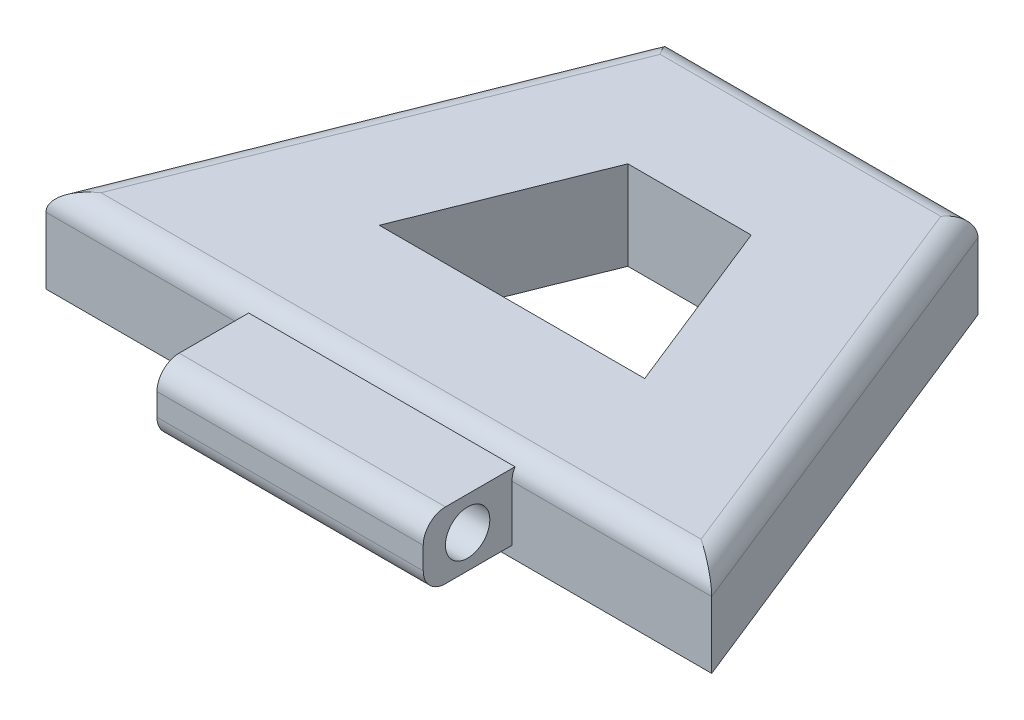
from build123d import *

# Parameters (mm, degrees)
BOSS_EXTRUDE1_DEPTH = 20
SKETCH2_W           = 60
SKETCH2_H           = 15
BOSS_EXTRUDE2_DEPTH = 20
SKETCH3_R           = 5
CUT_EXTRUDE1_DEPTH  = 147.372811683
FILLET1_R           = 5


with BuildPart() as part:
    # Sketch1 → Boss-Extrude1 (new body)
    with BuildSketch(Plane(origin=(0, 0, 0), x_dir=(1, 0, 0), z_dir=(0, 1, 0))):
        Polygon((-35, 100), (35, 100), (75, 0), (-75, 0), align=None)
        Polygon((-13.9, 70), (13.9, 70), (29.9, 30), (-29.9, 30), align=None, mode=Mode.SUBTRACT)
    extrude(amount=BOSS_EXTRUDE1_DEPTH)

    # Sketch2 → Boss-Extrude2 (add)
    with BuildSketch(Plane.XY):
        with Locations((0, 10)):
            Rectangle(SKETCH2_W, SKETCH2_H)
    extrude(amount=BOSS_EXTRUDE2_DEPTH)

    # Sketch3 → Cut-Extrude1 (cut, through all)
    with BuildSketch(Plane(origin=(30, 0, 0), x_dir=(0, 0, -1), z_dir=(1, 0, 0))):
        with Locations((-10, 10)):
            Circle(SKETCH3_R)
    extrude(amount=-CUT_EXTRUDE1_DEPTH, mode=Mode.SUBTRACT)

    # Fillet1
    # the kernel refuses this fillet: 5 mm, written as the material it takes off along each edge
    with BuildSketch(Plane(origin=(87.5, 20, 0), x_dir=(0, 0, -1), z_dir=(-1, 0, 0))) as fillet1_piece_1_section:
        with BuildLine():
            CenterArc((FILLET1_R, FILLET1_R), FILLET1_R, 180, 90)
            Line((0, FILLET1_R), (0, 0))
            Line((0, 0), (FILLET1_R, 0))
        make_face()
    fillet1_piece_1 = extrude(amount=175, mode=Mode.PRIVATE)
    fillet1_piece_1 = split(fillet1_piece_1, bisect_by=Plane(origin=(30, 19.178041178, -1.2756003), z_dir=(1, 0, 0)), keep=Keep.TOP, mode=Mode.PRIVATE)
    fillet1_piece_1 = split(fillet1_piece_1, bisect_by=Plane(origin=(58.75, 17.5, -1.2756003), z_dir=(0, 1, 0)), keep=Keep.TOP, mode=Mode.PRIVATE)
    add(fillet1_piece_1, mode=Mode.SUBTRACT)
    with BuildSketch(Plane(origin=(87.5, 20, 0), x_dir=(0, 0, -1), z_dir=(-1, 0, 0))) as fillet1_piece_2_section:
        with BuildLine():
            CenterArc((FILLET1_R, FILLET1_R), FILLET1_R, 180, 90)
            Line((0, FILLET1_R), (0, 0))
            Line((0, 0), (FILLET1_R, 0))
        make_face()
    fillet1_piece_2 = extrude(amount=175, mode=Mode.PRIVATE)
    fillet1_piece_2 = split(fillet1_piece_2, bisect_by=Plane(origin=(30, 16.683746077, -0.120041908), z_dir=(1, 0, 0)), keep=Keep.TOP, mode=Mode.PRIVATE)
    fillet1_piece_2 = split(fillet1_piece_2, bisect_by=Plane(origin=(58.75, 17.5, -0.120041908), z_dir=(0, -1, 0)), keep=Keep.TOP, mode=Mode.PRIVATE)
    add(fillet1_piece_2, mode=Mode.SUBTRACT)
    with BuildSketch(Plane(origin=(87.5, 20, 0), x_dir=(0, 0, -1), z_dir=(-1, 0, 0))) as fillet1_piece_3_section:
        with BuildLine():
            CenterArc((FILLET1_R, FILLET1_R), FILLET1_R, 180, 90)
            Line((0, FILLET1_R), (0, 0))
            Line((0, 0), (FILLET1_R, 0))
        make_face()
    fillet1_piece_3 = extrude(amount=175, mode=Mode.PRIVATE)
    fillet1_piece_3 = split(fillet1_piece_3, bisect_by=Plane(origin=(-30, 19.178041178, -1.2756003), z_dir=(1, 0, 0)), keep=Keep.TOP, mode=Mode.PRIVATE)
    fillet1_piece_3 = split(fillet1_piece_3, bisect_by=Plane(origin=(30, 19.178041178, -1.2756003), z_dir=(-1, 0, 0)), keep=Keep.TOP, mode=Mode.PRIVATE)
    fillet1_piece_3 = split(fillet1_piece_3, bisect_by=Plane(origin=(0, 17.5, -1.2756003), z_dir=(0, 1, 0)), keep=Keep.TOP, mode=Mode.PRIVATE)
    add(fillet1_piece_3, mode=Mode.SUBTRACT)
    with BuildSketch(Plane(origin=(87.5, 20, 0), x_dir=(0, 0, -1), z_dir=(-1, 0, 0))) as fillet1_piece_4_section:
        with BuildLine():
            CenterArc((FILLET1_R, FILLET1_R), FILLET1_R, 180, 90)
            Line((0, FILLET1_R), (0, 0))
            Line((0, 0), (FILLET1_R, 0))
        make_face()
    fillet1_piece_4 = extrude(amount=175, mode=Mode.PRIVATE)
    fillet1_piece_4 = split(fillet1_piece_4, bisect_by=Plane(origin=(-30, 19.178041178, -1.2756003), z_dir=(-1, 0, 0)), keep=Keep.TOP, mode=Mode.PRIVATE)
    fillet1_piece_4 = split(fillet1_piece_4, bisect_by=Plane(origin=(-58.75, 17.5, -1.2756003), z_dir=(0, 1, 0)), keep=Keep.TOP, mode=Mode.PRIVATE)
    add(fillet1_piece_4, mode=Mode.SUBTRACT)
    with BuildSketch(Plane(origin=(87.5, 20, 0), x_dir=(0, 0, -1), z_dir=(-1, 0, 0))) as fillet1_piece_5_section:
        with BuildLine():
            CenterArc((FILLET1_R, FILLET1_R), FILLET1_R, 180, 90)
            Line((0, FILLET1_R), (0, 0))
            Line((0, 0), (FILLET1_R, 0))
        make_face()
    fillet1_piece_5 = extrude(amount=175, mode=Mode.PRIVATE)
    fillet1_piece_5 = split(fillet1_piece_5, bisect_by=Plane(origin=(-30, 16.683746077, -0.120041908), z_dir=(-1, 0, 0)), keep=Keep.TOP, mode=Mode.PRIVATE)
    fillet1_piece_5 = split(fillet1_piece_5, bisect_by=Plane(origin=(-58.75, 17.5, -0.120041908), z_dir=(0, -1, 0)), keep=Keep.TOP, mode=Mode.PRIVATE)
    add(fillet1_piece_5, mode=Mode.SUBTRACT)
    with BuildSketch(Plane(origin=(-79.642383454, 20, 11.605958636), x_dir=(0, -1, 0), z_dir=(0.37139067635410355, 0, -0.9284766908852595)), Plane(origin=(30.357616546, 20, -111.605958636), x_dir=(0, -1, 0), z_dir=(0.37139067635410383, 0, 0.9284766908852593))) as fillet1_piece_6:
        with BuildLine():
            CenterArc((FILLET1_R, -FILLET1_R), FILLET1_R, 90, 90)
            Line((0, -FILLET1_R), (0, 0))
            Line((0, 0), (FILLET1_R, 0))
        make_face()
    extrude(amount=132.703296143, mode=Mode.SUBTRACT)
    with BuildSketch(Plane(origin=(-47.5, 20, -100), x_dir=(0, -1, 0), z_dir=(1, 0, 0))) as fillet1_piece_7:
        with BuildLine():
            CenterArc((FILLET1_R, -FILLET1_R), FILLET1_R, 90, 90)
            Line((0, -FILLET1_R), (0, 0))
            Line((0, 0), (FILLET1_R, 0))
        make_face()
    extrude(amount=95, mode=Mode.SUBTRACT)
    with BuildSketch(Plane(origin=(42.5, 2.5, 20), x_dir=(0, 0, -1), z_dir=(-1, 0, 0)), Plane(origin=(-42.5, 17.5, 20), x_dir=(0, 0, -1), z_dir=(1, 0, 0))) as fillet1_piece_8:
        with BuildLine():
            CenterArc((FILLET1_R, -FILLET1_R), FILLET1_R, 90, 90)
            Line((0, -FILLET1_R), (0, 0))
            Line((0, 0), (FILLET1_R, 0))
        make_face()
    extrude(amount=85, mode=Mode.SUBTRACT)


solid = part.part
